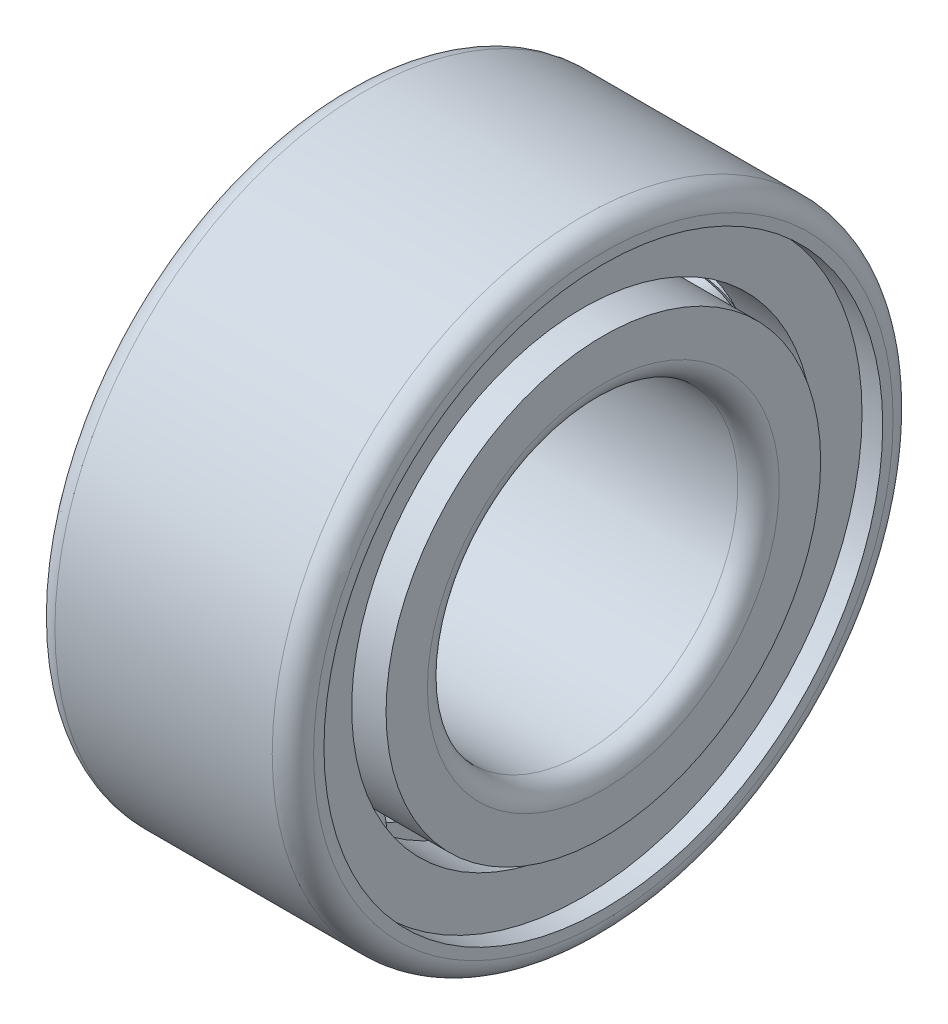
from build123d import *

# Parameters (mm, degrees)
SKETCH_2_W               = 0.176
SKETCH_2_H               = 0.22
PATTERN_CIRCULAR_1_COUNT = 10
SKETCH_4_W               = 0.88
SKETCH_4_H               = 0.44
SKETCH_5_W               = 0.88
SKETCH_5_H               = 0.44
PATTERN_CIRCULAR_2_COUNT = 10
SKETCH_10_W              = 0.535202389
SKETCH_10_H              = 0.368
SKETCH_11_R              = 3
CUT_EXTRUDE_1_DEPTH      = 10


with BuildPart() as part:
    # 草图2 → Revolve 389 (revolve)
    with BuildSketch(Plane.XY):
        with Locations((0, 2.4)):
            Rectangle(SKETCH_2_W, SKETCH_2_H)
    revolve(axis=Axis((-12.420610377, 0, 0), (1, 0, 0)))

    # 草图3 → 凸台-旋转1 (revolve)
    with BuildSketch(Plane.XY):
        with BuildLine():
            Line((-0.44, 2.4), (0.44, 2.4))
            ThreePointArc((0.44, 2.4), (0, 1.96), (-0.44, 2.4))
        make_face()
    revolve_1 = revolve(axis=Axis((-5.568093779, 2.4, 0), (1, 0, 0)))

    # 阵列(圆周)1: 凸台-旋转1 ×10 about axis
    pattern_circular_1_axis = Axis((-12.420610377, 0, 0), (1, 0, 0))
    for i in range(1, PATTERN_CIRCULAR_1_COUNT):
        add(revolve_1.rotate(pattern_circular_1_axis, i * 360 / PATTERN_CIRCULAR_1_COUNT))

    # 草图4 → 切除-旋转1 (revolve, cut)
    with BuildSketch(Plane.XY):
        with Locations((0, 2.73)):
            Rectangle(SKETCH_4_W, SKETCH_4_H)
    revolve(axis=Axis((0, 0, 0), (1, 0, 0)), mode=Mode.SUBTRACT)

    # 草图5 → 切除-旋转2 (revolve, cut)
    with BuildSketch(Plane.XY):
        with Locations((0, 2.07)):
            Rectangle(SKETCH_5_W, SKETCH_5_H)
    revolve(axis=Axis((0, 0, 0), (1, 0, 0)), mode=Mode.SUBTRACT)

    # 草图6 → 凸台-旋转2 (revolve)
    with BuildSketch(Plane.XY):
        with BuildLine():
            Line((-0.4, 2.4), (0.4, 2.4))
            ThreePointArc((0.4, 2.4), (0, 2), (-0.4, 2.4))
        make_face()
    revolve_2 = revolve(axis=Axis((-5.568093779, 2.4, 0), (1, 0, 0)))

    # 阵列(圆周)2: 凸台-旋转2 ×10 about axis
    pattern_circular_2_axis = Axis((-12.420610377, 0, 0), (1, 0, 0))
    for i in range(1, PATTERN_CIRCULAR_2_COUNT):
        add(revolve_2.rotate(pattern_circular_2_axis, i * 360 / PATTERN_CIRCULAR_2_COUNT))

    # 草图7 → 凸台-旋转3 (revolve)
    with BuildSketch(Plane.XY):
        with BuildLine():
            Line((-1.05, 3), (1.05, 3))
            ThreePointArc((1.05, 3), (1.191421356, 2.941421356), (1.25, 2.8))
            Line((1.25, 2.8), (1.25, 2.7))
            Line((1.25, 2.7), (1.05, 2.7))
            Line((1.05, 2.7), (1.05, 2.6))
            Line((1.05, 2.6), (0.514797611, 2.6))
            Line((0.514797611, 2.6), (0.514797611, 2.7))
            Line((0.514797611, 2.7), (0.249198716, 2.7))
            ThreePointArc((0.249198716, 2.7), (0, 2.79), (-0.249198716, 2.7))
            Line((-0.249198716, 2.7), (-1.25, 2.7))
            Line((-1.25, 2.7), (-1.25, 2.8))
            ThreePointArc((-1.25, 2.8), (-1.191421356, 2.941421356), (-1.05, 3))
        make_face()
    revolve(axis=Axis((0, 0, 0), (1, 0, 0)))

    # 草图8 → 凸台-旋转4 (revolve)
    with BuildSketch(Plane.XY):
        with BuildLine():
            Line((-1.25, 2.1), (-0.249198716, 2.1))
            ThreePointArc((-0.249198716, 2.1), (0, 2.01), (0.249198716, 2.1))
            Line((0.249198716, 2.1), (1.25, 2.1))
            Line((1.25, 2.1), (1.25, 1.7))
            ThreePointArc((1.25, 1.7), (1.191421356, 1.558578644), (1.05, 1.5))
            Line((1.05, 1.5), (-1.05, 1.5))
            ThreePointArc((-1.05, 1.5), (-1.191421356, 1.558578644), (-1.25, 1.7))
            Line((-1.25, 1.7), (-1.25, 2.1))
        make_face()
    revolve(axis=Axis((-12.420610377, 0, 0), (1, 0, 0)))

    # 草图10 → 凸台-旋转5 (revolve)
    with BuildSketch(Plane.XY):
        with Locations((0.782398805, 2.416)):
            Rectangle(SKETCH_10_W, SKETCH_10_H)
    revolve(axis=Axis((0, 0, 0), (-1, 0, 0)))

    # 草图11 → 切除-拉伸1 (cut)
    with BuildSketch(Plane(origin=(0, 0, 0), x_dir=(0, 0, -1), z_dir=(1, 0, 0))):
        Circle(SKETCH_11_R)
    extrude(amount=-CUT_EXTRUDE_1_DEPTH, mode=Mode.SUBTRACT)

    # 镜向所有1: part across plane


with BuildPart() as part_1:
    add(part.part)
    add(part.part.mirror(Plane(origin=(0, 0, 0), x_dir=(0, 0, 1), z_dir=(1, 0, 0))))


solid = part_1.part
